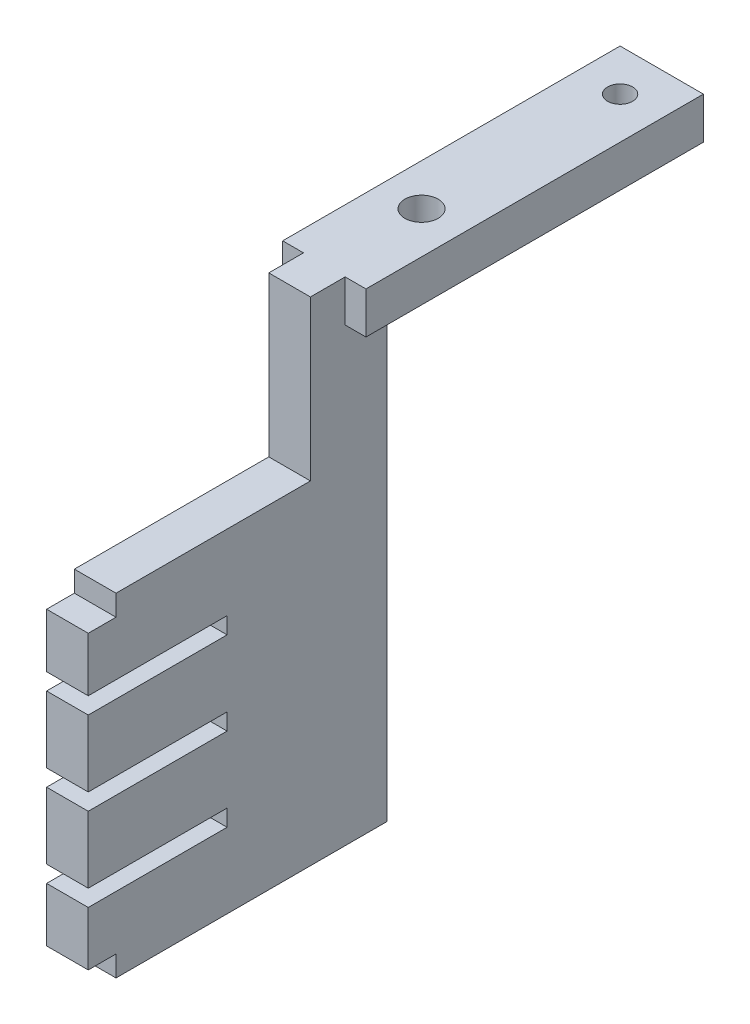
from build123d import *

# Parameters (mm, degrees)
BOSS_EXTRUDE1_START     = 7.2
SKETCH1_W               = 6
SKETCH1_H               = 3
BOSS_EXTRUDE1_DEPTH     = 24.3
BOSS_EXTRUDE2_START     = 28.5
SKETCH2_W               = 3
SKETCH2_H               = 35.475
BOSS_EXTRUDE2_DEPTH     = 21.5
CUT_EXTRUDE1_DEPTH      = 60.023009285
CUT_EXTRUDE1_DEPTH_BACK = 60.023009285
SKETCH3_R               = 1.2
SKETCH3_R_2             = 0.9
CUT_EXTRUDE2_DEPTH      = 60.023009285
CUT_EXTRUDE2_DEPTH_BACK = 60.023009285
SKETCH4_W               = 11
SKETCH4_H               = 1.2
SKETCH4_W_2             = 17
SKETCH4_H_2             = 12.475
CUT_EXTRUDE3_DEPTH      = 60.023009285
CUT_EXTRUDE3_DEPTH_BACK = 60.023009285
SKETCH5_W               = 3
SKETCH5_H               = 2.5


with BuildPart() as part:
    # Sketch1 → Boss-Extrude1 (new body)
    with BuildSketch(Plane.XY.offset(BOSS_EXTRUDE1_START)):
        with Locations((17.8, 21.975)):
            Rectangle(SKETCH1_W, SKETCH1_H)
    extrude(amount=BOSS_EXTRUDE1_DEPTH)

    # Sketch2 → Boss-Extrude2 (add)
    with BuildSketch(Plane.XY.offset(BOSS_EXTRUDE2_START)):
        with Locations((17.8, 5.7375)):
            Rectangle(SKETCH2_W, SKETCH2_H)
    extrude(amount=BOSS_EXTRUDE2_DEPTH)

    # Sketch3 → Cut-Extrude1 (cut, two sides: drawn at the far end of the back side and taken through both)
    with BuildSketch(Plane(origin=(0, 0, 0), x_dir=(1, 0, 0), z_dir=(0, 1, 0)).offset(-CUT_EXTRUDE1_DEPTH_BACK)):
        with Locations((17.8, -24.5)):
            Circle(SKETCH3_R)
        with Locations((17.8, -10.2)):
            Circle(SKETCH3_R_2)
    extrude(amount=CUT_EXTRUDE1_DEPTH + CUT_EXTRUDE1_DEPTH_BACK, mode=Mode.SUBTRACT)

    # Sketch4 → Cut-Extrude2 (cut, two sides: drawn at the far end of the back side and taken through both)
    with BuildSketch(Plane(origin=(0, 0, 0), x_dir=(0, 0, -1), z_dir=(1, 0, 0)).offset(-CUT_EXTRUDE2_DEPTH_BACK)):
        with Locations((-45.5, -6)):
            Rectangle(SKETCH4_W, SKETCH4_H)
        with Locations((-45.5, 0)):
            Rectangle(SKETCH4_W, SKETCH4_H)
        with Locations((-45.5, 6)):
            Rectangle(SKETCH4_W, SKETCH4_H)
        with Locations((-42.5, 18.2375)):
            Rectangle(SKETCH4_W_2, SKETCH4_H_2)
    extrude(amount=CUT_EXTRUDE2_DEPTH + CUT_EXTRUDE2_DEPTH_BACK, mode=Mode.SUBTRACT)

    # Sketch5 → Cut-Extrude3 (cut, two sides: drawn at the far end of the back side and taken through both)
    with BuildSketch(Plane(origin=(0, 0, 0), x_dir=(0, 0, -1), z_dir=(1, 0, 0)).offset(-CUT_EXTRUDE3_DEPTH_BACK)):
        with Locations((-49.5, -11.75)):
            Rectangle(SKETCH5_W, SKETCH5_H)
        with Locations((-49.5, 11.75)):
            Rectangle(SKETCH5_W, SKETCH5_H)
    extrude(amount=CUT_EXTRUDE3_DEPTH + CUT_EXTRUDE3_DEPTH_BACK, mode=Mode.SUBTRACT)


solid = part.part
